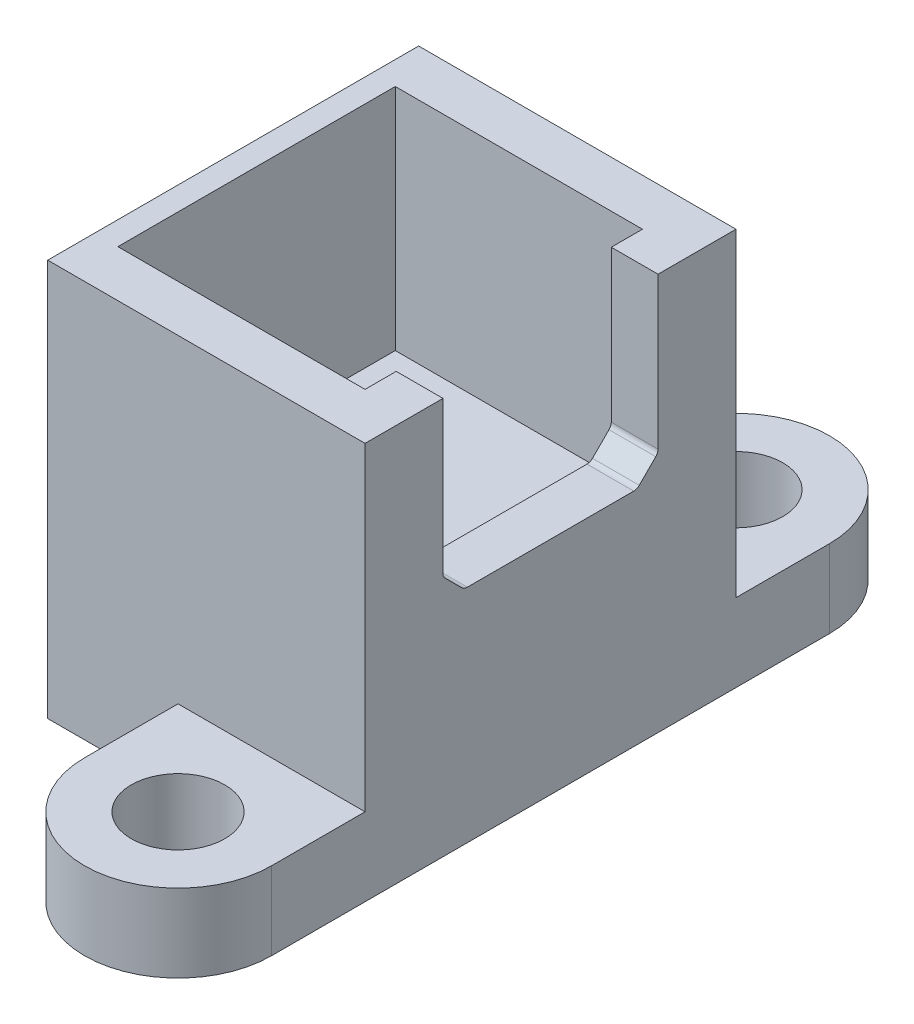
from build123d import *

# Parameters (mm, degrees)
BOSS_EXTRUDE6_START     = 1.5
BOSS_EXTRUDE6_DEPTH     = 1.5
BOSS_EXTRUDE7_START     = 3
SKETCH1_5_W             = 11.9
SKETCH1_5_H             = 5.3
SKETCH1_5_W_2           = 1.5
SKETCH1_5_H_2           = 5.936611654
BOSS_EXTRUDE7_DEPTH     = 7.93
BOSS_EXTRUDE8_START     = 10.93
BOSS_EXTRUDE8_OUTLINE_W = 11.9
BOSS_EXTRUDE8_OUTLINE_H = 12.736611654
BOSS_EXTRUDE8_DEPTH     = 0.75
SKETCH4_R               = 1.5
BOSS_EXTRUDE10_DEPTH    = 2.5


# Read off the part's stored shape, not the designer's step: Boss-Extrude8
with BuildPart() as part:
    # Sketch1 → Boss-Extrude6 (new body)
    with BuildSketch(Plane.ZY.offset(94.76563723).offset(BOSS_EXTRUDE6_START)):
        with BuildLine():
            Line((-51.759425025, -53.863488773), (-52.289755114, -53.333158684))
            ThreePointArc((-52.289755114, -53.333158684), (-52.343100233, -53.254101332), (-52.362978418, -53.160824194))
            Line((-52.362978418, -53.160824194), (-52.362978418, -48.300100424))
            Line((-52.362978418, -48.300100424), (-54.862978418, -48.300100424))
            Line((-54.862978418, -48.300100424), (-54.862978418, -61.036712078))
            Line((-54.862978418, -61.036712078), (-42.962978418, -61.036712078))
            Line((-42.962978418, -61.036712078), (-42.962978418, -48.300100424))
            Line((-42.962978418, -48.300100424), (-45.462978418, -48.300100424))
            Line((-45.462978418, -48.300100424), (-45.462978418, -53.156381989))
            ThreePointArc((-45.462978418, -53.156381989), (-45.482008535, -53.252052847), (-45.536201723, -53.333158684))
            Line((-45.536201723, -53.333158684), (-46.066531809, -53.86348877))
            ThreePointArc((-46.066531809, -53.86348877), (-46.147637646, -53.917681958), (-46.243308504, -53.936712075))
            Line((-46.243308504, -53.936712075), (-51.582648329, -53.936712078))
            ThreePointArc((-51.582648329, -53.936712078), (-51.678319187, -53.917681961), (-51.759425025, -53.863488773))
        make_face()
    extrude(amount=BOSS_EXTRUDE6_DEPTH)

    # Sketch1<5> → Boss-Extrude7 (add)
    with BuildSketch(Plane.ZY.offset(94.76563723).offset(BOSS_EXTRUDE7_START)):
        with Locations((-48.912978418, -58.386712078)):
            Rectangle(SKETCH1_5_W, SKETCH1_5_H)
        Polygon((-53.362978418, -55.636712078), (-53.362978418, -54.236712078), (-54.862978418, -54.236712078), (-54.862978418, -55.736712078), (-42.962978418, -55.736712078), (-42.962978418, -54.236712078), (-44.462978418, -54.236712078), (-44.462978418, -55.636712078), align=None)
        with Locations((-54.112978418, -51.268406251)):
            Rectangle(SKETCH1_5_W_2, SKETCH1_5_H_2)
        with Locations((-43.712978418, -51.268406251)):
            Rectangle(SKETCH1_5_W_2, SKETCH1_5_H_2)
    extrude(amount=BOSS_EXTRUDE7_DEPTH)

    # Boss-Extrude8 outline → Boss-Extrude8 (add)
    with BuildSketch(Plane.ZY.offset(94.76563723).offset(BOSS_EXTRUDE8_START)):
        with Locations((-48.912978418, -54.668406251)):
            Rectangle(BOSS_EXTRUDE8_OUTLINE_W, BOSS_EXTRUDE8_OUTLINE_H)
    extrude(amount=BOSS_EXTRUDE8_DEPTH)

    # Sketch4 → Boss-Extrude10 (add)
    # profile 1 of 2: a face of its own
    with BuildSketch(Plane.XZ.offset(61.036712078)):
        with BuildLine():
            Line((-102.26563723, -39.962978418), (-102.26563723, -42.962978418))
            Line((-102.26563723, -42.962978418), (-96.26563723, -42.962978418))
            Line((-96.26563723, -42.962978418), (-96.26563723, -39.962978418))
            ThreePointArc((-96.26563723, -39.962978418), (-99.26563723, -36.962978418), (-102.26563723, -39.962978418))
        make_face()
        with Locations(Location((-99.26563723, -39.962978418, 0), (0, 0, 270))):
            Circle(SKETCH4_R, mode=Mode.SUBTRACT)
    # profile 2 of 2: a face of its own
    with BuildSketch(Plane.XZ.offset(61.036712078)):
        with BuildLine():
            Line((-96.26563723, -57.862978418), (-96.26563723, -54.862978418))
            Line((-96.26563723, -54.862978418), (-102.26563723, -54.862978418))
            Line((-102.26563723, -54.862978418), (-102.26563723, -57.862978418))
            ThreePointArc((-102.26563723, -57.862978418), (-99.26563723, -60.862978418), (-96.26563723, -57.862978418))
        make_face()
        with Locations(Location((-99.26563723, -57.862978418, 0), (0, 0, 270))):
            Circle(SKETCH4_R, mode=Mode.SUBTRACT)
    extrude(amount=-BOSS_EXTRUDE10_DEPTH)


solid = part.part
